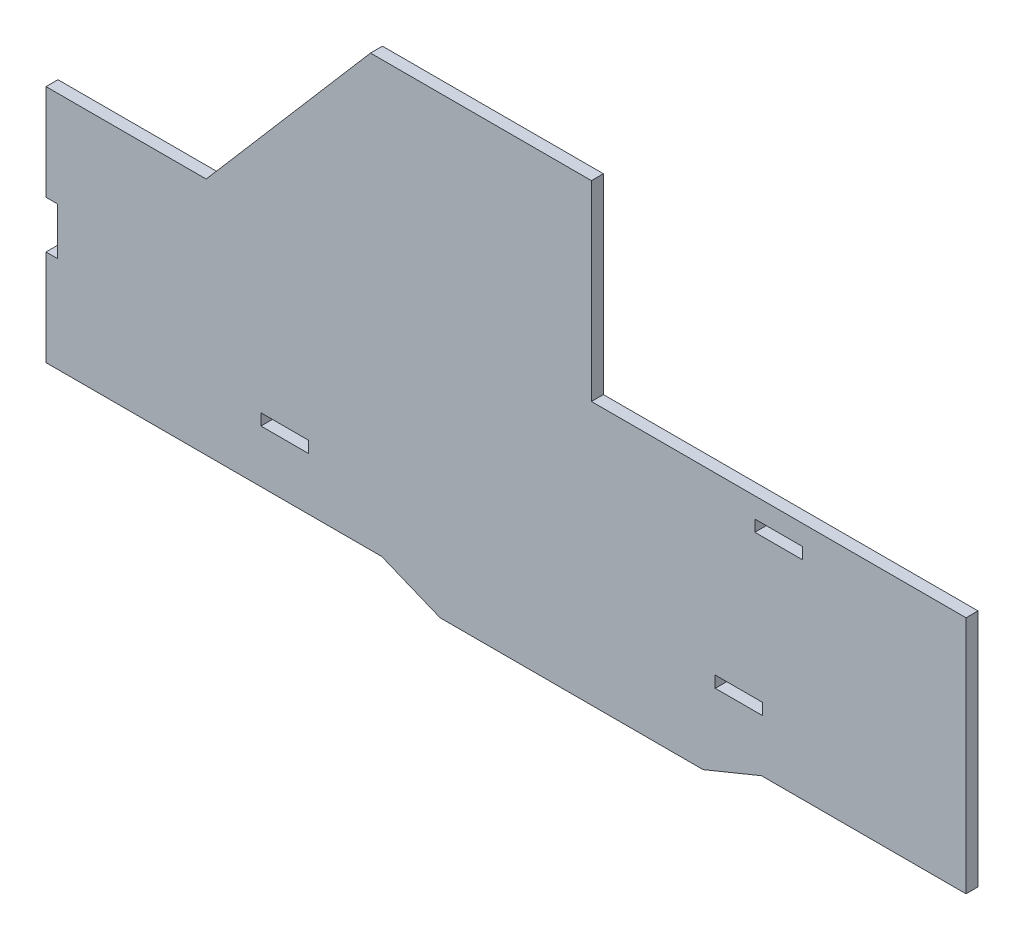
from build123d import *

# Parameters (mm, degrees)
MAIN_SIDE_DEPTH          = 3.175
SKETCH2_W                = 12.573
SKETCH2_H                = 3.048
BOTTOM_PLATE_HOLES_DEPTH = 239.465654669
SKETCH3_W                = 12.7
SKETCH3_H                = 3.048
CUT_EXTRUDE1_DEPTH       = 239.465654669
SKETCH4_W                = 3.048
SKETCH4_H                = 12.573
CUT_EXTRUDE2_DEPTH       = 239.465654669


with BuildPart() as part:
    # Sketch1 → Main Side (new body)
    with BuildSketch(Plane.XY):
        Polygon((62.123903317, 6.35), (131.966346795, 6.35), (147.472889282, 12.7), (201.808790274, 12.7), (201.808790274, 76.2), (102.314133739, 76.2), (102.314133739, 127), (43.639361702, 127), (0, 76.2), (-42.539209726, 76.2), (-42.539209726, 12.7), (46.617360741, 12.7), align=None)
    extrude(amount=MAIN_SIDE_DEPTH)

    # Sketch2 → Bottom Plate Holes (cut, through all)
    with BuildSketch(Plane.XY.offset(3.175)):
        with Locations((141.483790274, 28.194)):
            Rectangle(SKETCH2_W, SKETCH2_H)
        with Locations((20.833790274, 28.194)):
            Rectangle(SKETCH2_W, SKETCH2_H)
    extrude(amount=-BOTTOM_PLATE_HOLES_DEPTH, mode=Mode.SUBTRACT)

    # Sketch3 → Cut-Extrude1 (cut, through all)
    with BuildSketch(Plane.XY.offset(3.175)):
        with Locations((152.061462006, 69.342)):
            Rectangle(SKETCH3_W, SKETCH3_H)
    extrude(amount=-CUT_EXTRUDE1_DEPTH, mode=Mode.SUBTRACT)

    # Sketch4 → Cut-Extrude2 (cut, through all)
    with BuildSketch(Plane.XY.offset(3.175)):
        with Locations((-41.015209726, 44.45)):
            Rectangle(SKETCH4_W, SKETCH4_H)
    extrude(amount=-CUT_EXTRUDE2_DEPTH, mode=Mode.SUBTRACT)


solid = part.part
